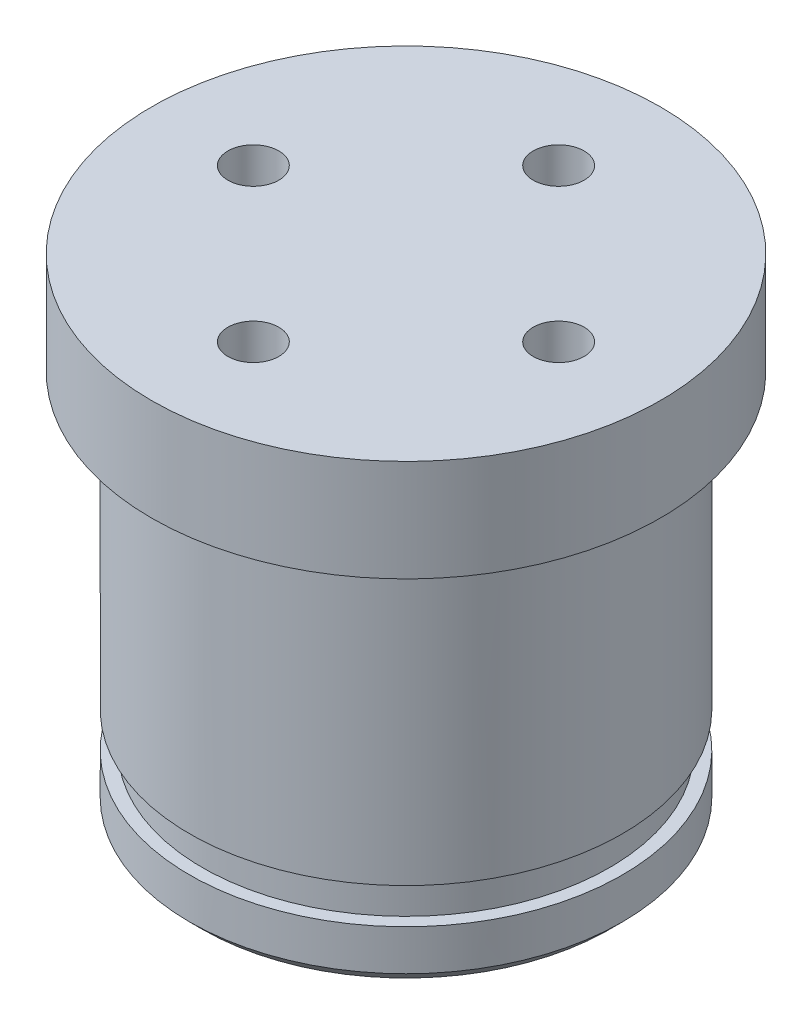
from build123d import *

# Parameters (mm, degrees)
SKETCH_1_R          = 8.5
EXTRUDE_1_DEPTH     = 15
SKETCH_2_R          = 10
EXTRUDE_2_DEPTH     = 4
SKETCH_3_R          = 1
CUT_EXTRUDE_1_DEPTH = 24.685438565
CUT_EXTRUDE_START   = -2.1
SKETCH_4_R          = 8.5
SKETCH_4_R_2        = 8
CUT_EXTRUDE_2_DEPTH = 1.4
CHAMFER_1_SIZE      = 0.5


with BuildPart() as part:
    # Эскиз1 → Бобышка-Вытянуть1 (new body)
    with BuildSketch(Plane(origin=(0, 0, 0), x_dir=(1, 0, 0), z_dir=(0, 1, 0))):
        Circle(SKETCH_1_R)
    extrude(amount=EXTRUDE_1_DEPTH)

    # Эскиз2 → Бобышка-Вытянуть2 (add)
    with BuildSketch(Plane(origin=(0, 15, 0), x_dir=(1, 0, 0), z_dir=(0, 1, 0))):
        Circle(SKETCH_2_R)
    extrude(amount=EXTRUDE_2_DEPTH)

    # Эскиз3 → Вырез-Вытянуть1 (cut, through all)
    with BuildSketch(Plane.XZ):
        with Locations((0, 6)):
            Circle(SKETCH_3_R)
        with Locations((6, 0)):
            Circle(SKETCH_3_R)
        with Locations((0, -6)):
            Circle(SKETCH_3_R)
        with Locations((-6, 0)):
            Circle(SKETCH_3_R)
    extrude(amount=-CUT_EXTRUDE_1_DEPTH, mode=Mode.SUBTRACT)

    # Эскиз4 → Вырез-Вытянуть2 (cut)
    with BuildSketch(Plane.XZ.offset(CUT_EXTRUDE_START)):
        Circle(SKETCH_4_R)
        Circle(SKETCH_4_R_2, mode=Mode.SUBTRACT)
    extrude(amount=-CUT_EXTRUDE_2_DEPTH, mode=Mode.SUBTRACT)

    # Фаска1
    chamfer_1_edges = [part.edges().sort_by_distance(p)[0] for p in [
        (-8.5, 0, 0),
    ]]
    chamfer(chamfer_1_edges, length=CHAMFER_1_SIZE)


solid = part.part
